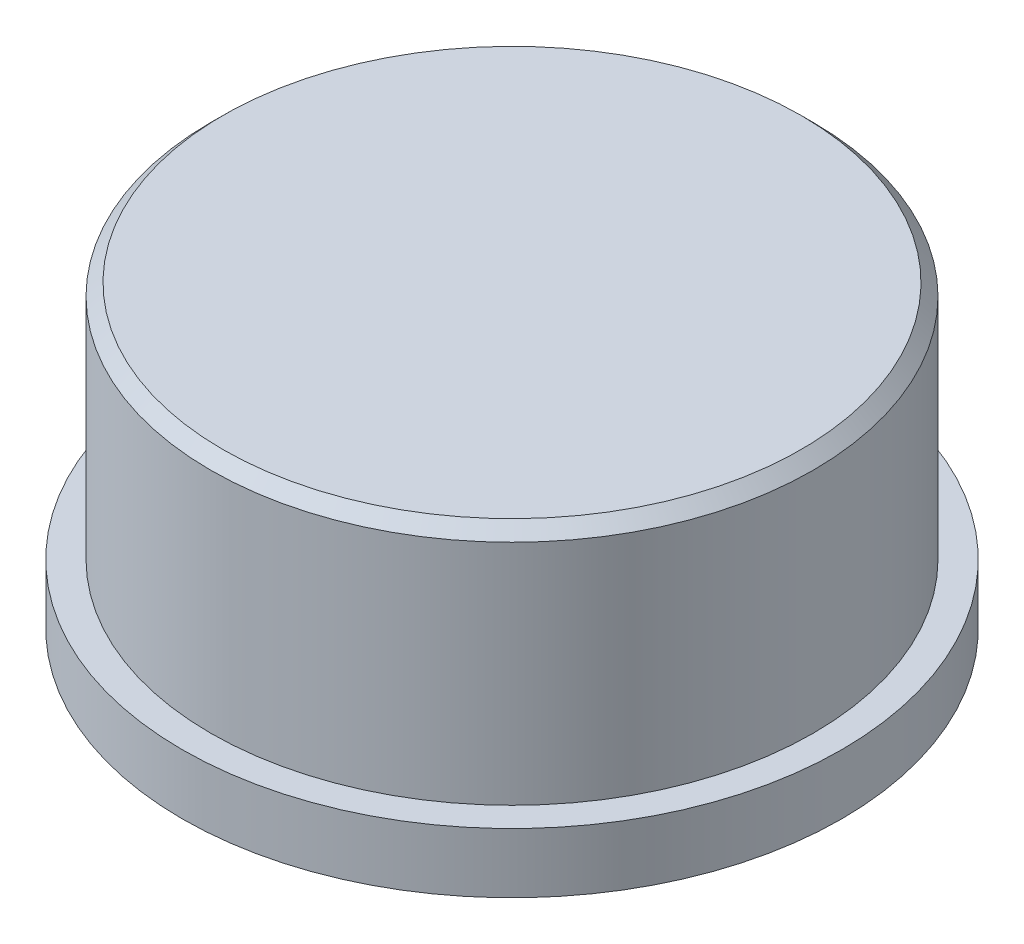
from build123d import *

# Parameters (mm, degrees)
SKETCH1_R           = 5.5
BOSS_EXTRUDE1_DEPTH = 1
SKETCH2_R           = 5.025
BOSS_EXTRUDE2_DEPTH = 4
CUT_EXTRUDE1_DEPTH  = 4
CHAMFER1_SIZE       = 0.2


with BuildPart() as part:
    # Sketch1 → Boss-Extrude1 (new body)
    with BuildSketch(Plane(origin=(0, 0, 0), x_dir=(1, 0, 0), z_dir=(0, 1, 0))):
        Circle(SKETCH1_R)
    extrude(amount=BOSS_EXTRUDE1_DEPTH)

    # Sketch2 → Boss-Extrude2 (add)
    with BuildSketch(Plane(origin=(0, 1, 0), x_dir=(1, 0, 0), z_dir=(0, 1, 0))):
        Circle(SKETCH2_R)
    extrude(amount=BOSS_EXTRUDE2_DEPTH)

    # Sketch3 → Cut-Extrude1 (cut)
    with BuildSketch(Plane.XZ):
        Polygon((3.0022214, 0), (1.5011107, 2.6), (-1.5011107, 2.6), (-3.0022214, 0), (-1.5011107, -2.6), (1.5011107, -2.6), align=None)
    extrude(amount=-CUT_EXTRUDE1_DEPTH, mode=Mode.SUBTRACT)

    # Chamfer1
    chamfer1_edges = [part.edges().sort_by_distance(p)[0] for p in [
        (-5.025, 5, 0),
    ]]
    chamfer(chamfer1_edges, length=CHAMFER1_SIZE)


solid = part.part
